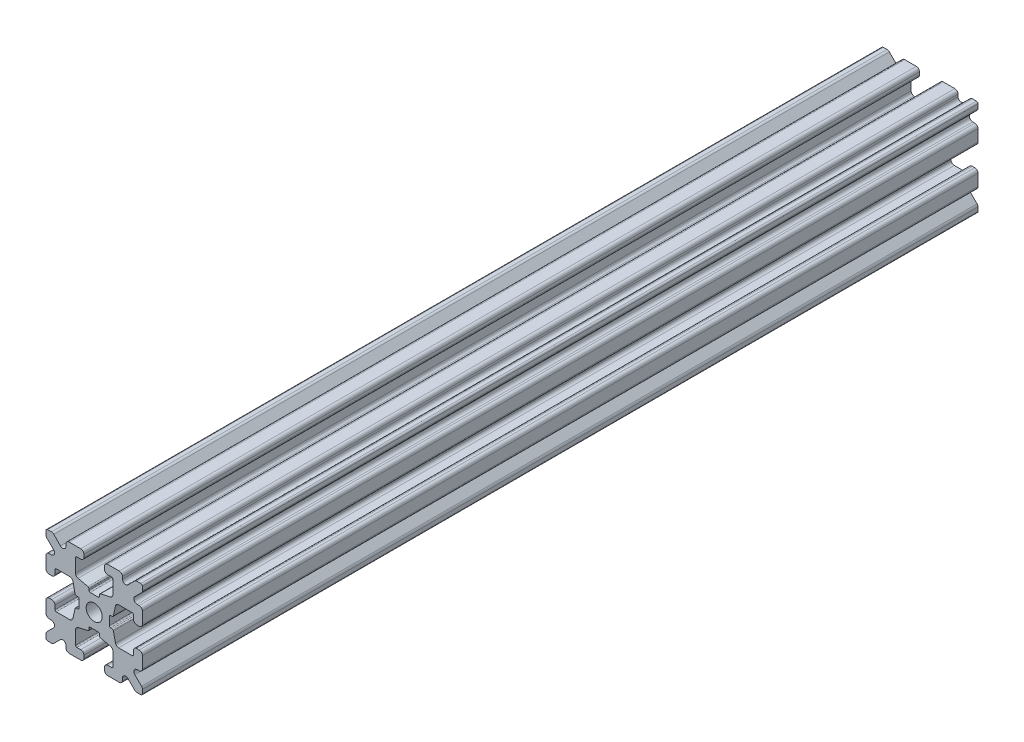
from build123d import *

# Parameters (mm, degrees)
SKETCH1_W           = 15
SKETCH1_H           = 15
SKETCH1_R           = 1.25
BOSS_EXTRUDE1_DEPTH = 65
FILLET1_R           = 0.25
CUT_EXTRUDE1_DEPTH  = 131.431974607
CUT_EXTRUDE3_DEPTH  = 131.431974607
FILLET3_R           = 0.5
FILLET4_R           = 0.5
FILLET5_R           = 3
FILLET6_R           = 0.2
CUT_EXTRUDE4_DEPTH  = 131.431974607
FILLET8_R           = 0.5
SKETCH6_W           = 5.1529354
SKETCH6_H           = 1.651
SKETCH6_W_2         = 1.651
SKETCH6_H_2         = 5.1529354
CUT_EXTRUDE5_DEPTH  = 131.431974607
FILLET10_R          = 0.2


with BuildPart() as part:
    # Sketch1 → Boss-Extrude1 (new, symmetric)
    with BuildSketch(Plane.XY):
        Rectangle(SKETCH1_W, SKETCH1_H)
        Circle(SKETCH1_R, mode=Mode.SUBTRACT)
    extrude(amount=BOSS_EXTRUDE1_DEPTH, both=True)

    # Fillet1
    fillet1_edges = [part.edges().sort_by_distance(p)[0] for p in [
        (7.5, -7.5, 0),
        (-7.5, -7.5, 0),
        (7.5, 7.5, 0),
        (-7.5, 7.5, 0),
    ]]
    fillet(fillet1_edges, radius=FILLET1_R)

    # Sketch2 → Cut-Extrude1 (cut, through all)
    with BuildSketch(Plane.XY.offset(65)):
        Polygon((-7.5, 1.6), (-6.1, 1.6), (-6.1, 2.9), (-3.4, 2.9), (-3.4, -2.9), (-6.1, -2.9), (-6.1, -1.6), (-7.5, -1.6), align=None)
        Polygon((2.9, 6.1), (1.6, 6.1), (1.6, 7.5), (-1.6, 7.5), (-1.6, 6.1), (-2.9, 6.1), (-2.9, 3.4), (2.9, 3.4), align=None)
        Polygon((-1.6, -7.5), (-1.6, -6.1), (-2.9, -6.1), (-2.9, -3.4), (2.9, -3.4), (2.9, -6.1), (1.6, -6.1), (1.6, -7.5), align=None)
        Polygon((6.1, -2.9), (6.1, -1.6), (7.5, -1.6), (7.5, 1.6), (6.1, 1.6), (6.1, 2.9), (3.4, 2.9), (3.4, -2.9), align=None)
    extrude(amount=-CUT_EXTRUDE1_DEPTH, mode=Mode.SUBTRACT)

    # Sketch4 → Cut-Extrude3 (cut, through all)
    with BuildSketch(Plane.XY.offset(65)):
        Polygon((-3.4, 2.9), (-2.75, 0), (-3.4, -2.9), align=None)
        Polygon((-2.9, 3.4), (0, 2.75), (2.9, 3.4), align=None)
        Polygon((3.4, 2.9), (2.75, 0), (3.4, -2.9), align=None)
        Polygon((-2.9, -3.4), (0, -2.75), (2.9, -3.4), align=None)
    extrude(amount=-CUT_EXTRUDE3_DEPTH, mode=Mode.SUBTRACT)

    # Fillet3
    fillet3_edges = [part.edges().sort_by_distance(p)[0] for p in [
        (-6.1, -1.6, 0),
        (-7.5, -1.6, 0),
        (-6.1, 1.6, 0),
        (-7.5, 1.6, 0),
        (-1.6, -7.5, 0),
        (-1.6, -6.1, 0),
        (1.6, -7.5, 0),
        (1.6, -6.1, 0),
        (6.1, -1.6, 0),
        (7.5, -1.6, 0),
        (7.5, 1.6, 0),
        (6.1, 1.6, 0),
        (1.6, 7.5, 0),
        (1.6, 6.1, 0),
        (-1.6, 7.5, 0),
        (-1.6, 6.1, 0),
    ]]
    fillet(fillet3_edges, radius=FILLET3_R)

    # Fillet4
    fillet4_edges = [part.edges().sort_by_distance(p)[0] for p in [
        (-3.4, 2.9, 0),
        (-3.4, -2.9, 0),
        (2.9, -3.4, 0),
        (-2.9, -3.4, 0),
        (3.4, -2.9, 0),
        (3.4, 2.9, 0),
        (-2.9, 3.4, 0),
        (2.9, 3.4, 0),
    ]]
    fillet(fillet4_edges, radius=FILLET4_R)

    # Fillet5
    fillet5_edges = [part.edges().sort_by_distance(p)[0] for p in [
        (0, -2.75, 0),
        (2.75, 0, 0),
        (-2.75, 0, 0),
        (0, 2.75, 0),
    ]]
    fillet(fillet5_edges, radius=FILLET5_R)

    # Fillet6
    fillet6_edges = [part.edges().sort_by_distance(p)[0] for p in [
        (-2.9, -6.1, 0),
        (2.9, -6.1, 0),
        (6.1, -2.9, 0),
        (6.1, 2.9, 0),
        (2.9, 6.1, 0),
        (-2.9, 6.1, 0),
        (-6.1, -2.9, 0),
        (-6.1, 2.9, 0),
    ]]
    fillet(fillet6_edges, radius=FILLET6_R)

    # Sketch5 → Cut-Extrude4 (cut, through all)
    with BuildSketch(Plane.XY.offset(65)):
        Polygon((-7.5, 6.439339828), (-5.460660172, 4.4), (-7.5, 4.4), align=None)
        Polygon((-6.439339828, 7.5), (-4.4, 5.460660172), (-4.4, 7.5), align=None)
        Polygon((4.4, 7.5), (6.439339828, 7.5), (4.4, 5.460660172), align=None)
        Polygon((7.5, 6.439339828), (7.5, 4.4), (5.460660172, 4.4), align=None)
        Polygon((7.5, -6.439339828), (5.460660172, -4.4), (7.5, -4.4), align=None)
        Polygon((6.439339828, -7.5), (4.4, -5.460660172), (4.4, -7.5), align=None)
        Polygon((-4.4, -7.5), (-6.439339828, -7.5), (-4.4, -5.460660172), align=None)
        Polygon((-7.5, -6.439339828), (-7.5, -4.4), (-5.460660172, -4.4), align=None)
    extrude(amount=-CUT_EXTRUDE4_DEPTH, mode=Mode.SUBTRACT)

    # Fillet8
    fillet8_edges = [part.edges().sort_by_distance(p)[0] for p in [
        (-5.460660172, 4.4, 0),
        (-7.5, 4.4, 0),
        (-5.460660172, -4.4, 0),
        (-7.5, -4.4, 0),
        (-4.4, -7.5, 0),
        (-4.4, -5.460660172, 0),
        (4.4, -7.5, 0),
        (4.4, -5.460660172, 0),
        (5.460660172, -4.4, 0),
        (7.5, -4.4, 0),
        (7.5, 4.4, 0),
        (5.460660172, 4.4, 0),
        (4.4, 5.460660172, 0),
        (4.4, 7.5, 0),
        (-4.4, 5.460660172, 0),
        (-4.4, 7.5, 0),
        (-6.439339828, 7.5, 0),
        (-7.5, 6.439339828, 0),
        (6.439339828, 7.5, 0),
        (7.5, 6.439339828, 0),
        (6.439339828, -7.5, 0),
        (7.5, -6.439339828, 0),
        (-6.439339828, -7.5, 0),
        (-7.5, -6.439339828, 0),
    ]]
    fillet(fillet8_edges, radius=FILLET8_R)

    # Sketch6 → Cut-Extrude5 (cut, through all)
    with BuildSketch(Plane.XY.offset(65)):
        with Locations((4.9235323, 0)):
            Rectangle(SKETCH6_W, SKETCH6_H)
        with Locations((0, -4.9235323)):
            Rectangle(SKETCH6_W_2, SKETCH6_H_2)
        with Locations((-4.9235323, 0)):
            Rectangle(SKETCH6_W, SKETCH6_H)
        with Locations((0, 4.9235323)):
            Rectangle(SKETCH6_W_2, SKETCH6_H_2)
    extrude(amount=-CUT_EXTRUDE5_DEPTH, mode=Mode.SUBTRACT)

    # Fillet10
    fillet10_edges = [part.edges().sort_by_distance(p)[0] for p in [
        (-2.935025862, 0.8255, 0),
        (-2.935025862, -0.8255, 0),
        (2.935025862, -0.8255, 0),
        (2.935025862, 0.8255, 0),
        (0.8255, 2.935025862, 0),
        (-0.8255, 2.935025862, 0),
        (-2.3470646, 0.8255, 0),
        (-2.3470646, -0.8255, 0),
        (0.8255, 2.3470646, 0),
        (-0.8255, 2.3470646, 0),
        (2.3470646, 0.8255, 0),
        (2.3470646, -0.8255, 0),
        (0.8255, -2.935025862, 0),
        (0.8255, -2.3470646, 0),
        (-0.8255, -2.3470646, 0),
        (-0.8255, -2.935025862, 0),
    ]]
    fillet(fillet10_edges, radius=FILLET10_R)


solid = part.part
